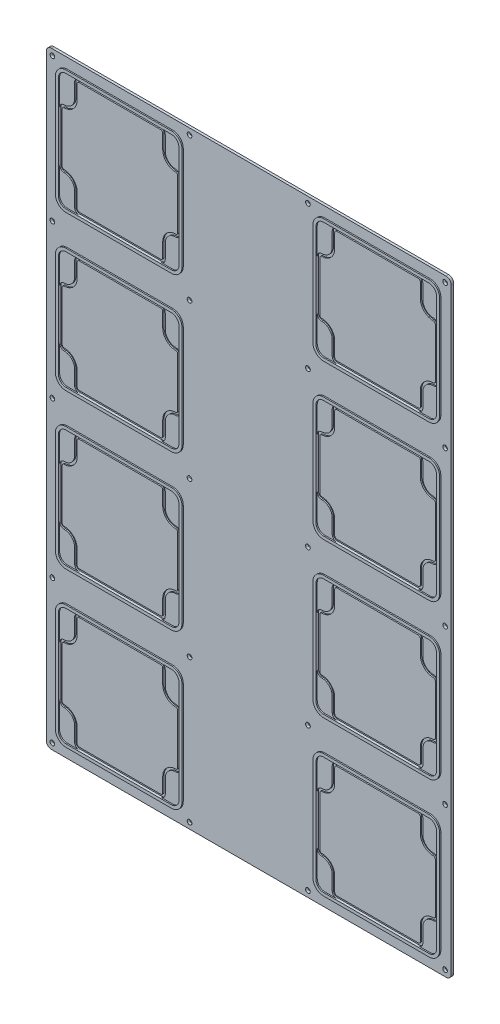
from build123d import *

# Parameters (mm, degrees)
SKETCH1_W            = 254
SKETCH1_H            = 381
BOSS_EXTRUDE1_DEPTH  = 1.5875
SKETCH2_R            = 1.4732
CUT_EXTRUDE1_DEPTH   = 458.907763809
FILLET1_R            = 3.175
CUT_EXTRUDE2_DEPTH   = 0.79375
BOSS_EXTRUDE2_DEPTH  = 0.79375
LPATTERN1_COUNT      = 4
LPATTERN1_PITCH      = 96.8756
LPATTERN1_COUNT_DIR2 = 2
LPATTERN1_PITCH_DIR2 = 161.5948


with BuildPart() as part:
    # Sketch1 → Boss-Extrude1 (new body)
    with BuildSketch(Plane.XY):
        with Locations((127, 190.5)):
            Rectangle(SKETCH1_W, SKETCH1_H)
    extrude(amount=BOSS_EXTRUDE1_DEPTH)

    # Sketch2 → Cut-Extrude1 (cut, through all)
    with BuildSketch(Plane.XY.offset(1.5875)):
        with Locations((3.81, 377.19)):
            Circle(SKETCH2_R)
        with Locations((89.8652, 377.19)):
            Circle(SKETCH2_R)
        with Locations((164.1348, 377.19)):
            Circle(SKETCH2_R)
        with Locations((250.19, 377.19)):
            Circle(SKETCH2_R)
        with Locations((164.1348, 287.375451288)):
            Circle(SKETCH2_R)
        with Locations((3.81, 287.3756)):
            Circle(SKETCH2_R)
        with Locations((250.19, 287.3756)):
            Circle(SKETCH2_R)
        with Locations((89.8652, 287.3756)):
            Circle(SKETCH2_R)
        with Locations((164.1348, 190.499990436)):
            Circle(SKETCH2_R)
        with Locations((3.81, 191.135)):
            Circle(SKETCH2_R)
        with Locations((250.19, 190.5)):
            Circle(SKETCH2_R)
        with Locations((89.8652, 190.5)):
            Circle(SKETCH2_R)
        with Locations((164.1348, 93.6244)):
            Circle(SKETCH2_R)
        with Locations((3.81, 93.6244)):
            Circle(SKETCH2_R)
        with Locations((250.19, 93.6244)):
            Circle(SKETCH2_R)
        with Locations((89.8652, 93.6244)):
            Circle(SKETCH2_R)
        with Locations((164.1348, 3.81)):
            Circle(SKETCH2_R)
        with Locations((3.81, 3.81)):
            Circle(SKETCH2_R)
        with Locations((250.19, 3.81)):
            Circle(SKETCH2_R)
        with Locations((89.8652, 3.81)):
            Circle(SKETCH2_R)
    extrude(amount=-CUT_EXTRUDE1_DEPTH, mode=Mode.SUBTRACT)

    # Fillet1
    fillet1_edges = [part.edges().sort_by_distance(p)[0] for p in [
        (254, 0, 0.79375),
        (0, 0, 0.79375),
        (254, 381, 0.79375),
        (0, 381, 0.79375),
    ]]
    fillet(fillet1_edges, radius=FILLET1_R)

    # Sketch3 → Cut-Extrude2 (cut)
    with BuildSketch(Plane.XY.offset(1.5875)):
        with BuildLine():
            Line((17.78, 79.1718), (17.78, 70.1802))
            ThreePointArc((17.78, 70.1802), (15.853172671, 65.528427329), (11.2014, 63.6016))
            ThreePointArc((11.2014, 63.6016), (9.207783141, 62.775816859), (8.382, 60.7822))
            Line((8.382, 60.7822), (8.382, 29.591))
            ThreePointArc((8.382, 29.591), (9.207783141, 27.597383141), (11.2014, 26.7716))
            ThreePointArc((11.2014, 26.7716), (15.853172671, 24.844772671), (17.78, 20.193))
            Line((17.78, 20.193), (17.78, 11.2014))
            ThreePointArc((17.78, 11.2014), (18.605783141, 9.207783141), (20.5994, 8.382))
            Line((20.5994, 8.382), (71.8058, 8.382))
            ThreePointArc((71.8058, 8.382), (73.799416859, 9.207783141), (74.6252, 11.2014))
            Line((74.6252, 11.2014), (74.6252, 20.193))
            ThreePointArc((74.6252, 20.193), (76.552027329, 24.844772671), (81.2038, 26.7716))
            ThreePointArc((81.2038, 26.7716), (83.197416859, 27.597383141), (84.0232, 29.591))
            Line((84.0232, 29.591), (84.0232, 60.7822))
            ThreePointArc((84.0232, 60.7822), (83.197416859, 62.775816859), (81.2038, 63.6016))
            ThreePointArc((81.2038, 63.6016), (76.552027329, 65.528427329), (74.6252, 70.1802))
            Line((74.6252, 70.1802), (74.6252, 79.1718))
            ThreePointArc((74.6252, 79.1718), (73.799416859, 81.165416859), (71.8058, 81.9912))
            Line((71.8058, 81.9912), (20.5994, 81.9912))
            ThreePointArc((20.5994, 81.9912), (18.605783141, 81.165416859), (17.78, 79.1718))
        make_face()
        with BuildLine():
            Line((82.4357, 29.591), (82.4357, 60.7822))
            ThreePointArc((82.4357, 60.7822), (82.074884844, 61.653284844), (81.2038, 62.0141))
            ThreePointArc((81.2038, 62.0141), (75.429495314, 64.405895314), (73.0377, 70.1802))
            Line((73.0377, 70.1802), (73.0377, 79.1718))
            ThreePointArc((73.0377, 79.1718), (72.676884844, 80.042884844), (71.8058, 80.4037))
            Line((71.8058, 80.4037), (20.5994, 80.4037))
            ThreePointArc((20.5994, 80.4037), (19.728315156, 80.042884844), (19.3675, 79.1718))
            Line((19.3675, 79.1718), (19.3675, 70.1802))
            ThreePointArc((19.3675, 70.1802), (16.975704686, 64.405895314), (11.2014, 62.0141))
            ThreePointArc((11.2014, 62.0141), (10.330315156, 61.653284844), (9.9695, 60.7822))
            Line((9.9695, 60.7822), (9.9695, 29.591))
            ThreePointArc((9.9695, 29.591), (10.330315156, 28.719915156), (11.2014, 28.3591))
            ThreePointArc((11.2014, 28.3591), (16.975704686, 25.967304686), (19.3675, 20.193))
            Line((19.3675, 20.193), (19.3675, 11.2014))
            ThreePointArc((19.3675, 11.2014), (19.728315156, 10.330315156), (20.5994, 9.9695))
            Line((20.5994, 9.9695), (71.8058, 9.9695))
            ThreePointArc((71.8058, 9.9695), (72.676884844, 10.330315156), (73.0377, 11.2014))
            Line((73.0377, 11.2014), (73.0377, 20.193))
            ThreePointArc((73.0377, 20.193), (75.429495314, 25.967304686), (81.2038, 28.3591))
            ThreePointArc((81.2038, 28.3591), (82.074884844, 28.719915156), (82.4357, 29.591))
        make_face(mode=Mode.SUBTRACT)
    cut_extrude2 = extrude(amount=-CUT_EXTRUDE2_DEPTH, mode=Mode.SUBTRACT)

    # Sketch4 → Boss-Extrude2 (add)
    with BuildSketch(Plane.XY.offset(1.5875)):
        with BuildLine():
            Line((6.477, 60.7822), (6.477, 77.2287))
            ThreePointArc((6.477, 77.2287), (8.429865536, 81.943334464), (13.1445, 83.8962))
            Line((13.1445, 83.8962), (20.5994, 83.8962))
            Line((20.5994, 83.8962), (79.2607, 83.8962))
            ThreePointArc((79.2607, 83.8962), (83.975334464, 81.943334464), (85.9282, 77.2287))
            Line((85.9282, 77.2287), (85.9282, 13.1445))
            ThreePointArc((85.9282, 13.1445), (83.975334464, 8.429865536), (79.2607, 6.477))
            Line((79.2607, 6.477), (13.1445, 6.477))
            ThreePointArc((13.1445, 6.477), (8.429865536, 8.429865536), (6.477, 13.1445))
            Line((6.477, 13.1445), (6.477, 60.7822))
        make_face()
        with BuildLine():
            Line((8.382, 60.7822), (8.382, 77.2287))
            ThreePointArc((8.382, 77.2287), (9.776903955, 80.596296045), (13.1445, 81.9912))
            Line((13.1445, 81.9912), (20.5994, 81.9912))
            Line((20.5994, 81.9912), (79.2607, 81.9912))
            ThreePointArc((79.2607, 81.9912), (82.628296045, 80.596296045), (84.0232, 77.2287))
            Line((84.0232, 77.2287), (84.0232, 13.1445))
            ThreePointArc((84.0232, 13.1445), (82.628296045, 9.776903955), (79.2607, 8.382))
            Line((79.2607, 8.382), (13.1445, 8.382))
            ThreePointArc((13.1445, 8.382), (9.776903955, 9.776903955), (8.382, 13.1445))
            Line((8.382, 13.1445), (8.382, 60.7822))
        make_face(mode=Mode.SUBTRACT)
    boss_extrude2 = extrude(amount=BOSS_EXTRUDE2_DEPTH)

    # LPattern1: Cut-Extrude2, Boss-Extrude2 4 × 2
    with Locations(*[(j * LPATTERN1_PITCH_DIR2, i * LPATTERN1_PITCH, 0) for i in range(LPATTERN1_COUNT) for j in range(LPATTERN1_COUNT_DIR2) if (i, j) != (0, 0)]):
        add(cut_extrude2, mode=Mode.SUBTRACT)
        add(boss_extrude2)


solid = part.part
